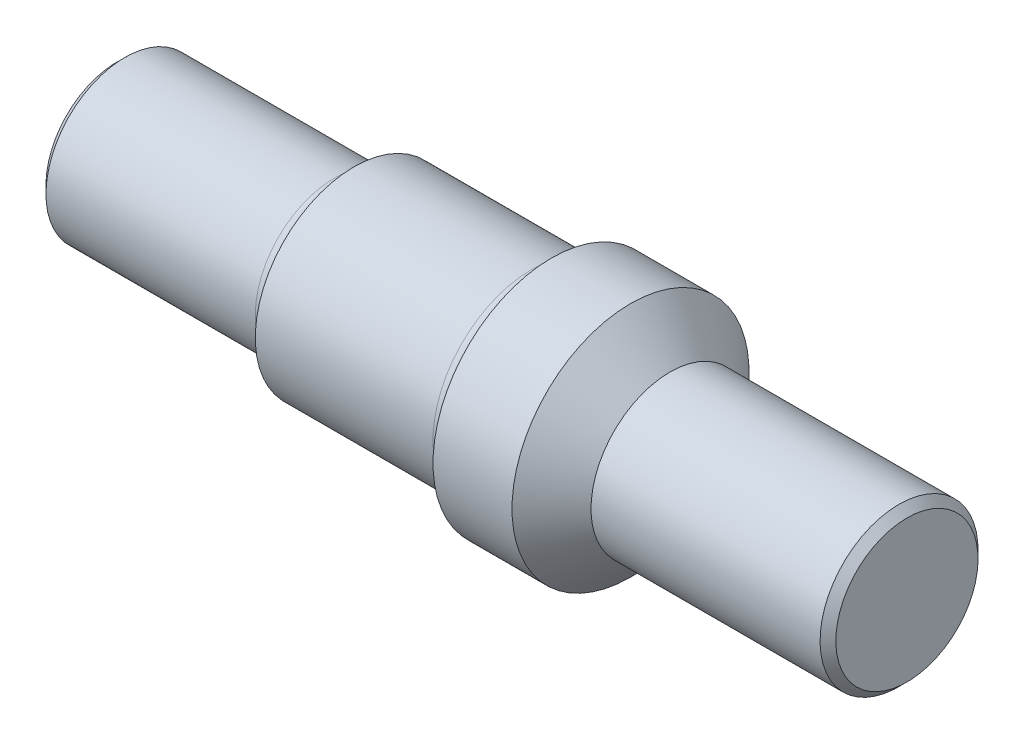
from build123d import *

# Parameters (mm, degrees)
FILLET1_R     = 2.5
CHAMFER1_SIZE = 1


with BuildPart() as part:
    # Sketch1 → Revolve1 (revolve)
    with BuildSketch(Plane.XY):
        Polygon((0, 0), (0, 10), (30, 10), (30, 12.5), (55, 12.5), (55, 15), (65, 15), (70, 10), (100, 10), (100, 0), align=None)
    revolve(axis=Axis((100, 0, 0), (-1, 0, 0)))

    # Fillet1
    fillet1_edges = [part.edges().sort_by_distance(p)[0] for p in [
        (30, -10, 0),
        (55, -12.5, 0),
    ]]
    fillet(fillet1_edges, radius=FILLET1_R - 0.0001)  # a hair under: the kernel refuses the full size

    # Chamfer1
    chamfer1_edges = [part.edges().sort_by_distance(p)[0] for p in [
        (0, -10, 0),
        (100, -10, 0),
    ]]
    chamfer(chamfer1_edges, length=CHAMFER1_SIZE)


solid = part.part
